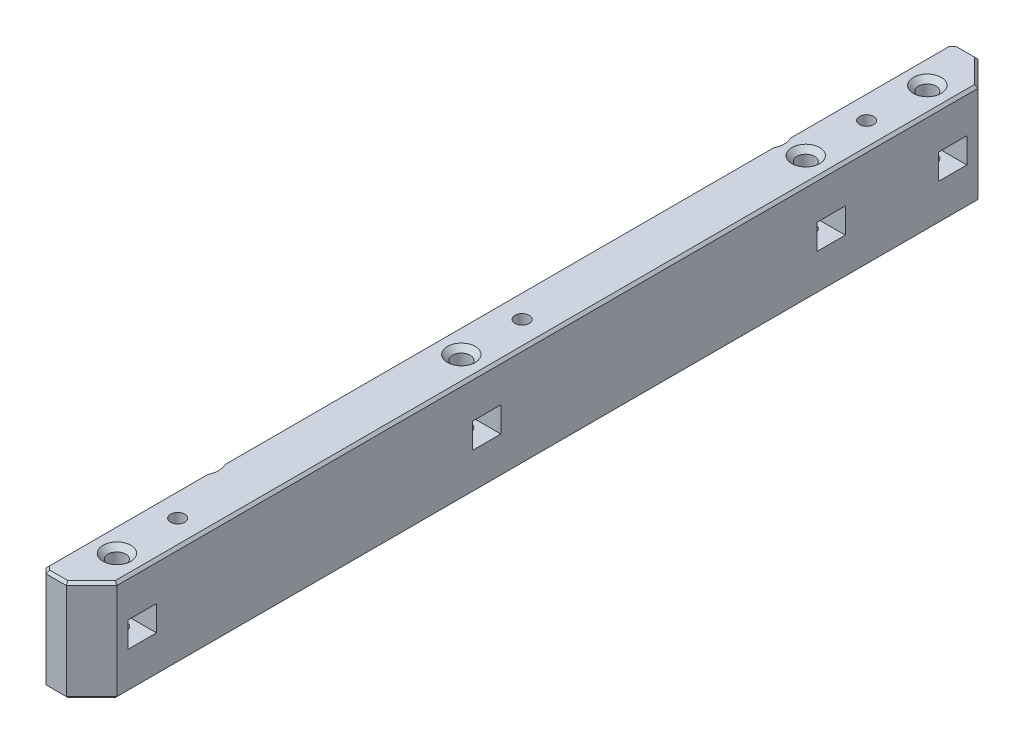
from build123d import *

# Parameters (mm, degrees)
SKETCH1_W           = 10
SKETCH1_H           = 20
BOSS_EXTRUDE1_DEPTH = 90
SKETCH6_R           = 1.75
CUT_EXTRUDE4_DEPTH  = 93.330926563
SKETCH7_R           = 1.4
CUT_EXTRUDE5_DEPTH  = 93.330926563
CUT_EXTRUDE6_START  = -10
CUT_EXTRUDE6_DEPTH  = 2.5
CHAMFER2_SIZE       = 5
CHAMFER3_SIZE       = 1
CHAMFER4_SIZE       = 0.5
CHAMFER5_SIZE       = 0.5
SKETCH10_R          = 3.75
CUT_EXTRUDE7_DEPTH  = 93.330926563


with BuildPart() as part:
    # Sketch1 → Boss-Extrude1 (new, symmetric)
    with BuildSketch(Plane.XY):
        Rectangle(SKETCH1_W, SKETCH1_H)
    extrude(amount=BOSS_EXTRUDE1_DEPTH, both=True)

    # Sketch6 → Cut-Extrude4 (cut, through all)
    with BuildSketch(Plane.XZ.offset(10)):
        with Locations((0, 80)):
            Circle(SKETCH6_R)
        with Locations((0, -80)):
            Circle(SKETCH6_R)
        with Locations((0, 12)):
            Circle(SKETCH6_R)
        with Locations((0, -56)):
            Circle(SKETCH6_R)
    extrude(amount=-CUT_EXTRUDE4_DEPTH, mode=Mode.SUBTRACT)

    # Sketch7 → Cut-Extrude5 (cut, through all)
    with BuildSketch(Plane(origin=(0, 10, 0), x_dir=(1, 0, 0), z_dir=(0, 1, 0))):
        with Locations((0, 68)):
            Circle(SKETCH7_R)
        Circle(SKETCH7_R)
        with Locations((0, -68)):
            Circle(SKETCH7_R)
    extrude(amount=-CUT_EXTRUDE5_DEPTH, mode=Mode.SUBTRACT)

    # Sketch9 → Cut-Extrude6 (cut, symmetric)
    with BuildSketch(Plane(origin=(0, 10, 0), x_dir=(1, 0, 0), z_dir=(0, 1, 0)).offset(CUT_EXTRUDE6_START)):
        Polygon((1.616580754, -77.2), (-1.616580754, -77.2), (-3.233161507, -80), (-1.616580754, -82.8), (1.616580754, -82.8), (12.756943772, -82.8), (12.756943772, -77.2), align=None)
        Polygon((-3.233161507, 80), (-1.616580754, 77.2), (1.616580754, 77.2), (12.756943772, 77.2), (12.756943772, 82.8), (1.616580754, 82.8), (-1.616580754, 82.8), align=None)
        Polygon((1.616580754, -9.2), (-1.616580754, -9.2), (-3.233161507, -12), (-1.616580754, -14.8), (1.616580754, -14.8), (12.756943772, -14.8), (12.756943772, -9.2), align=None)
        Polygon((1.616580754, 58.8), (-1.616580754, 58.8), (-3.233161507, 56), (-1.616580754, 53.2), (1.616580754, 53.2), (12.756943772, 53.2), (12.756943772, 58.8), align=None)
    extrude(amount=CUT_EXTRUDE6_DEPTH, both=True, mode=Mode.SUBTRACT)

    # Chamfer2
    chamfer2_edges = [part.edges().sort_by_distance(p)[0] for p in [
        (5, 0, -90),
        (5, 0, 90),
    ]]
    chamfer(chamfer2_edges, length=CHAMFER2_SIZE)

    # Chamfer3
    chamfer3_edges = [part.edges().sort_by_distance(p)[0] for p in [
        (-1.75, -10, -80),
        (-1.4, -10, 0),
        (-1.4, -10, 68),
        (-1.75, 10, 80),
        (-1.75, 10, -80),
        (-5, 0, -90),
        (-5, 0, 90),
        (-1.75, 10, -56),
        (-1.75, 10, 12),
    ]]
    chamfer(chamfer3_edges, length=CHAMFER3_SIZE)

    # Chamfer4
    chamfer4_edges = [part.edges().sort_by_distance(p)[0] for p in [
        (-4.5, -10, 89.5),
        (-2, -10, 90),
        (2.5, -10, 87.5),
        (5, -10, 0),
        (2.5, -10, -87.5),
        (-2, -10, -90),
        (-4.5, -10, -89.5),
        (-5, -10, 0),
    ]]
    chamfer(chamfer4_edges, length=CHAMFER4_SIZE)

    # Chamfer5
    chamfer5_edges = [part.edges().sort_by_distance(p)[0] for p in [
        (2.5, 10, -87.5),
        (5, 10, 0),
        (2.5, 10, 87.5),
        (-2, 10, 90),
        (-4.5, 10, 89.5),
        (-5, 10, 0),
        (-4.5, 10, -89.5),
        (-2, 10, -90),
    ]]
    chamfer(chamfer5_edges, length=CHAMFER5_SIZE)

    # Sketch10 → Cut-Extrude7 (cut, through all)
    with BuildSketch(Plane.XZ.offset(10)):
        with Locations((-7.848531477, -55.883586947)):
            Circle(SKETCH10_R)
        with Locations((-7.848531477, 55.883586947)):
            Circle(SKETCH10_R)
    extrude(amount=-CUT_EXTRUDE7_DEPTH, mode=Mode.SUBTRACT)


solid = part.part
